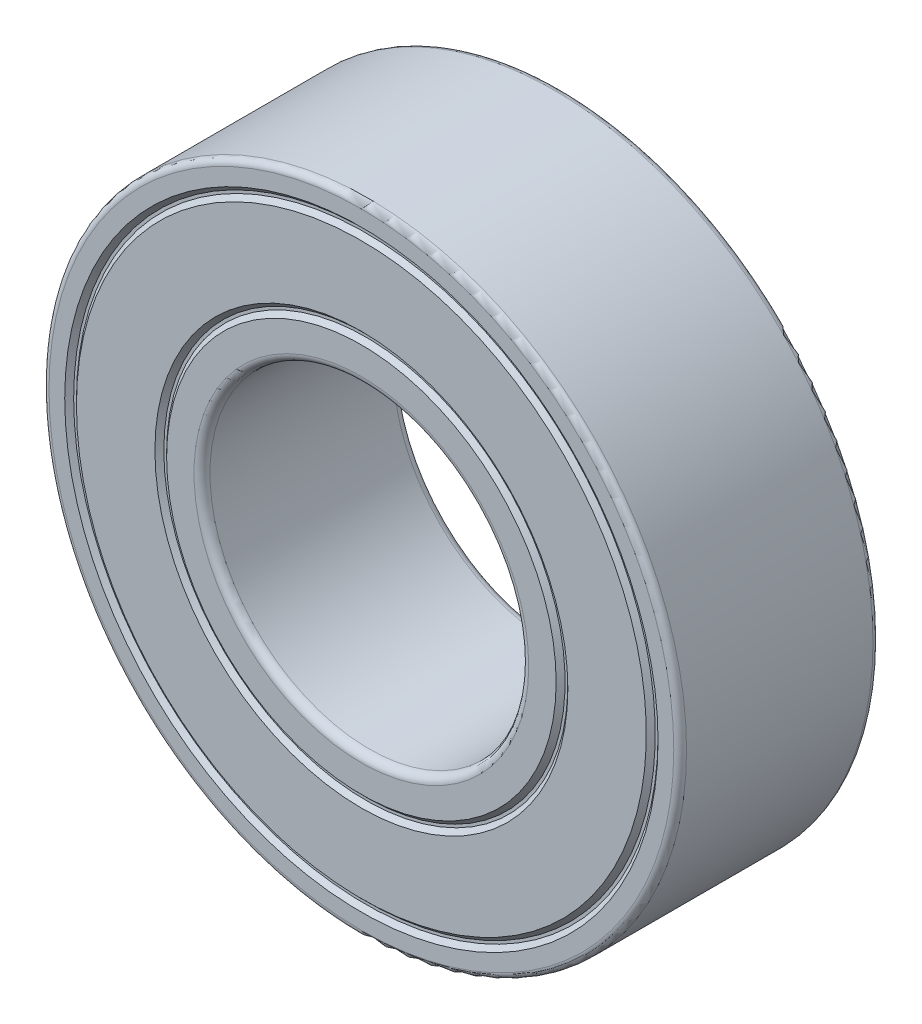
from build123d import *

# Parameters (mm, degrees)
SKETCH3_W         = 5
SKETCH3_H         = 0.666666667
SKETCH3_H_2       = 1
SKETCH4_R         = 1.4
CIRPATTERN1_COUNT = 7
FILLET1_R         = 0.16
FILLET2_R         = 0.2
CHAMFER1_SIZE     = 0.112
CHAMFER2_SIZE     = 0.112


# Read off the part's stored shape, not the designer's step: Thicken1
with BuildPart() as part:
    # Sketch3 → Revolve1 (revolve)
    with BuildSketch(Plane(origin=(0, 0, 0), x_dir=(0, 0, -1), z_dir=(1, 0, 0)), mode=Mode.PRIVATE) as revolve1_sk:
        with Locations((0, -7.666666667)):
            Rectangle(SKETCH3_W, SKETCH3_H)
        with Locations((0, -4.5)):
            Rectangle(SKETCH3_W, SKETCH3_H_2)
    revolve(revolve1_sk.sketch.rotate(Axis((0, 0, 2.5), (0, 0, -1)), 270), axis=Axis((0, 0, 2.5), (0, 0, -1)))

    # Sketch4 → Cut-Revolve1 (revolve, cut)
    with BuildSketch(Plane(origin=(0, 0, 0), x_dir=(0, 0, -1), z_dir=(1, 0, 0)), mode=Mode.PRIVATE) as cut_revolve1_sk:
        with Locations((0, -6.166666667)):
            Circle(SKETCH4_R)
    revolve(cut_revolve1_sk.sketch.rotate(Axis((0, 0, 2.5), (0, 0, -1)), 270), axis=Axis((0, 0, 2.5), (0, 0, -1)), mode=Mode.SUBTRACT)

    # Fillet1
    fillet1_edges = [part.edges().sort_by_distance(p)[0] for p in [
        (-8, 0, -2.5),
        (-8, 0, 2.5),
    ]]
    fillet(fillet1_edges, radius=FILLET1_R)

    # Fillet2
    fillet2_edges = [part.edges().sort_by_distance(p)[0] for p in [
        (-4, 0, -2.5),
        (-4, 0, 2.5),
    ]]
    fillet(fillet2_edges, radius=FILLET2_R)

    # Chamfer1
    chamfer1_edges = [part.edges().sort_by_distance(p)[0] for p in [
        (-7.333333333, 0, 2.5),
        (-7.333333333, 0, -2.5),
    ]]
    chamfer(chamfer1_edges, length=CHAMFER1_SIZE)

    # Chamfer2
    chamfer2_edges = [part.edges().sort_by_distance(p)[0] for p in [
        (-5, 0, 2.5),
        (-5, 0, -2.5),
    ]]
    chamfer(chamfer2_edges, length=CHAMFER2_SIZE)


with BuildPart() as body_2:
    # Sketch5 → Revolve2 (revolve)
    with BuildSketch(Plane(origin=(0, 0, 0), x_dir=(0, 0, -1), z_dir=(1, 0, 0))):
        with BuildLine():
            Line((0, -4.766666667), (0, -7.566666667))
            ThreePointArc((0, -7.566666667), (1.4, -6.166666667), (0, -4.766666667))
        make_face()
    revolve(axis=Axis((0, -4.766666667, 0), (0, -1, 0)))


with BuildPart() as cirpattern1_1:
    # CirPattern1: pattern copy
    add(body_2.part.rotate(Axis((0, 0, 0), (0, 0, 1)), 1 * 360 / CIRPATTERN1_COUNT))


with BuildPart() as cirpattern1_2:
    # CirPattern1: pattern copy
    add(body_2.part.rotate(Axis((0, 0, 0), (0, 0, 1)), 2 * 360 / CIRPATTERN1_COUNT))


with BuildPart() as cirpattern1_3:
    # CirPattern1: pattern copy
    add(body_2.part.rotate(Axis((0, 0, 0), (0, 0, 1)), 3 * 360 / CIRPATTERN1_COUNT))


with BuildPart() as cirpattern1_4:
    # CirPattern1: pattern copy
    add(body_2.part.rotate(Axis((0, 0, 0), (0, 0, 1)), 4 * 360 / CIRPATTERN1_COUNT))


with BuildPart() as cirpattern1_5:
    # CirPattern1: pattern copy
    add(body_2.part.rotate(Axis((0, 0, 0), (0, 0, 1)), 5 * 360 / CIRPATTERN1_COUNT))


with BuildPart() as cirpattern1_6:
    # CirPattern1: pattern copy
    add(body_2.part.rotate(Axis((0, 0, 0), (0, 0, 1)), 6 * 360 / CIRPATTERN1_COUNT))


with BuildPart() as body_9:
    # Thicken1 outline → Thicken1 (revolve)
    with BuildSketch(Plane.XZ):
        Polygon((5, 2.388), (5, 2.261), (5.122605122, 2.261), (5.234605122, 2.373), (7.098728211, 2.373), (7.210728211, 2.261), (7.333333333, 2.261), (7.333333333, 2.388), (7.263333333, 2.388), (7.151333333, 2.5), (5.182, 2.5), (5.07, 2.388), align=None)
    revolve(axis=Axis((0, 0, 0), (0, 0, 1)))


with BuildPart() as body_10:
    # Mirror1: mirrored copy
    add(body_9.part.mirror(Plane.XY))


solid = Compound([part.part, body_2.part, cirpattern1_1.part, cirpattern1_2.part, cirpattern1_3.part, cirpattern1_4.part, cirpattern1_5.part, cirpattern1_6.part, body_9.part, body_10.part])
